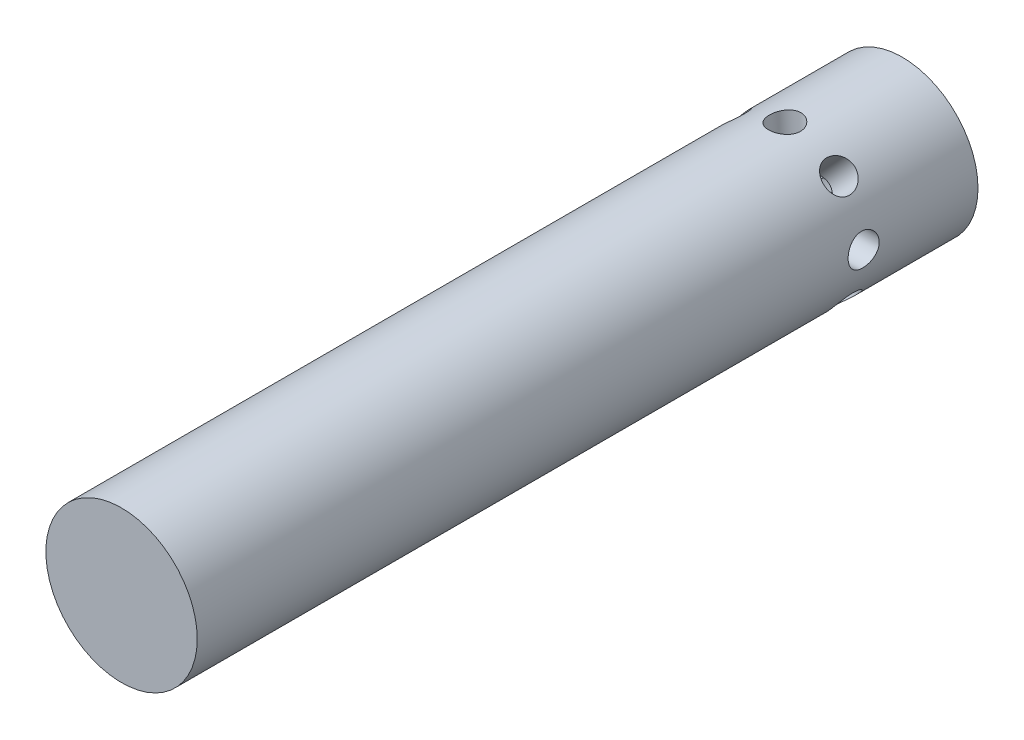
from build123d import *

# Parameters (mm, degrees)
SKETCH1_R           = 19.875
BOSS_EXTRUDE1_DEPTH = 205
SKETCH3_R           = 10
CUT_EXTRUDE1_DEPTH  = 50
SKETCH6_R           = 4.075854405
CUT_EXTRUDE2_DEPTH  = 10
CIRPATTERN1_COUNT   = 8


with BuildPart() as part:
    # Sketch1 → Boss-Extrude1 (new body)
    with BuildSketch(Plane.XY):
        Circle(SKETCH1_R)
    extrude(amount=-BOSS_EXTRUDE1_DEPTH)

    # Sketch3 → Cut-Extrude1 (cut)
    with BuildSketch(Plane(origin=(0, 0, -205), x_dir=(-1, 0, 0), z_dir=(0, 0, -1))):
        Circle(SKETCH3_R)
    extrude(amount=-CUT_EXTRUDE1_DEPTH, mode=Mode.SUBTRACT)

    # Sketch6 → Cut-Extrude2 (cut)
    with BuildSketch(Plane(origin=(0.842167668, -19.857149307, -205), x_dir=(-0.9991018519472621, -0.042373216016148636, 0), z_dir=(0.042373216016148636, -0.9991018519472621, 0))):
        with Locations((0, -30)):
            Circle(SKETCH6_R)
    cut_extrude2 = extrude(amount=-CUT_EXTRUDE2_DEPTH, mode=Mode.SUBTRACT)

    # CirPattern1: Cut-Extrude2 ×8 about axis
    cirpattern1_axis = Axis((0, 0, -205), (0, 0, 1))
    for i in range(1, CIRPATTERN1_COUNT):
        add(cut_extrude2.rotate(cirpattern1_axis, i * 360 / CIRPATTERN1_COUNT), mode=Mode.SUBTRACT)


solid = part.part
